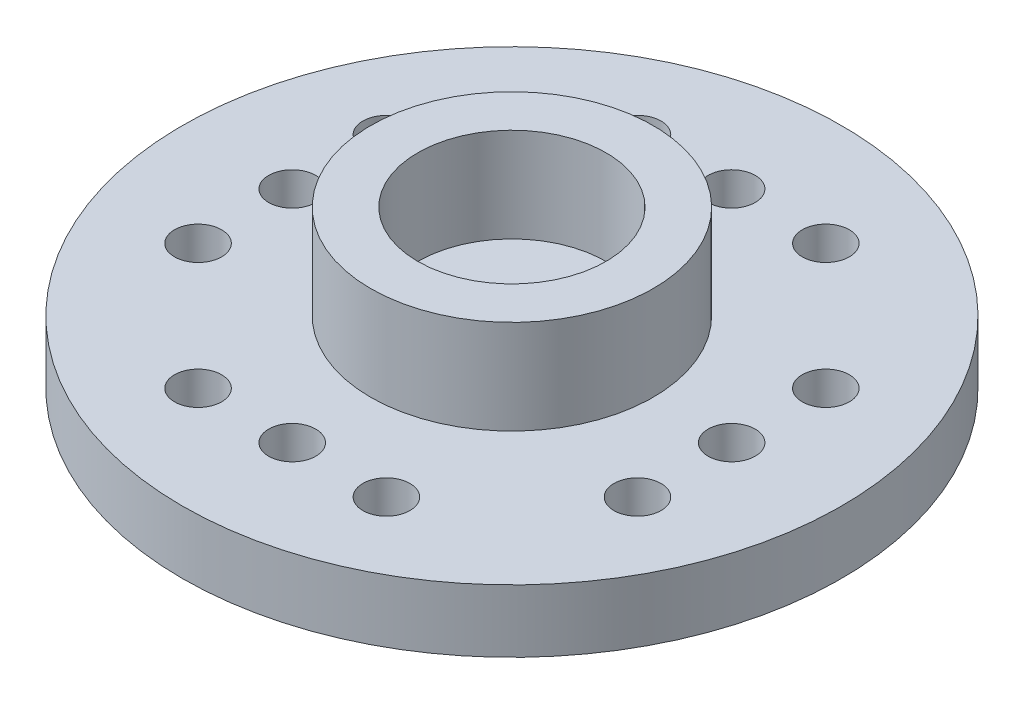
from build123d import *

# Parameters (mm, degrees)
SKETCH1_R           = 10.5
BOSS_EXTRUDE1_DEPTH = 2
SKETCH2_R           = 4.5
SKETCH2_R_2         = 3
BOSS_EXTRUDE2_DEPTH = 3
SKETCH3_R           = 1
CUT_EXTRUDE1_DEPTH  = 3
CUT_EXTRUDE2_START  = -0.5
SKETCH4_R           = 4.25
SKETCH4_R_2         = 3.25
SKETCH4_R_3         = 2.75
SKETCH4_R_4         = 1
CUT_EXTRUDE2_DEPTH  = 0.5
SKETCH5_R           = 0.75
CUT_EXTRUDE3_DEPTH  = 2.5
SKETCH7_R           = 0.75
CUT_EXTRUDE4_DEPTH  = 2.5


with BuildPart() as part:
    # Sketch1 → Boss-Extrude1 (new body)
    with BuildSketch(Plane(origin=(0, 0, 0), x_dir=(1, 0, 0), z_dir=(0, 1, 0))):
        Circle(SKETCH1_R)
    extrude(amount=BOSS_EXTRUDE1_DEPTH)

    # Sketch2 → Boss-Extrude2 (add)
    with BuildSketch(Plane(origin=(0, 2, 0), x_dir=(1, 0, 0), z_dir=(0, 1, 0))):
        Circle(SKETCH2_R)
        Circle(SKETCH2_R_2, mode=Mode.SUBTRACT)
    extrude(amount=BOSS_EXTRUDE2_DEPTH)

    # Sketch3 → Cut-Extrude1 (cut)
    with BuildSketch(Plane(origin=(0, 2, 0), x_dir=(1, 0, 0), z_dir=(0, 1, 0))):
        Circle(SKETCH3_R)
    extrude(amount=-CUT_EXTRUDE1_DEPTH, mode=Mode.SUBTRACT)

    # Sketch4 → Cut-Extrude2 (cut)
    # profile 1 of 2: a face of its own
    with BuildSketch(Plane.XZ.offset(CUT_EXTRUDE2_START)):
        Circle(SKETCH4_R)
        Circle(SKETCH4_R_2, mode=Mode.SUBTRACT)
    # profile 2 of 2: a face of its own
    with BuildSketch(Plane.XZ.offset(CUT_EXTRUDE2_START)):
        Circle(SKETCH4_R_3)
        Circle(SKETCH4_R_4, mode=Mode.SUBTRACT)
    extrude(amount=CUT_EXTRUDE2_DEPTH, mode=Mode.SUBTRACT)

    # Sketch5 → Cut-Extrude3 (cut)
    with BuildSketch(Plane.XZ):
        with Locations((0, 7)):
            Circle(SKETCH5_R)
        with Locations((3, 7)):
            Circle(SKETCH5_R)
        with Locations((-3, 7)):
            Circle(SKETCH5_R)
    cut_extrude3 = extrude(amount=-CUT_EXTRUDE3_DEPTH, mode=Mode.SUBTRACT)

    # Mirror1: Cut-Extrude3 across plane
    add(cut_extrude3.mirror(Plane.XY), mode=Mode.SUBTRACT)

    # Sketch7 → Cut-Extrude4 (cut)
    with BuildSketch(Plane.XZ):
        with Locations((7, 0)):
            Circle(SKETCH7_R)
        with Locations((7, 3)):
            Circle(SKETCH7_R)
        with Locations((7, -3)):
            Circle(SKETCH7_R)
    cut_extrude4 = extrude(amount=-CUT_EXTRUDE4_DEPTH, mode=Mode.SUBTRACT)

    # Mirror2: Cut-Extrude4 across plane
    add(cut_extrude4.mirror(Plane(origin=(0, 0, 0), x_dir=(0, 0, 1), z_dir=(1, 0, 0))), mode=Mode.SUBTRACT)


solid = part.part
